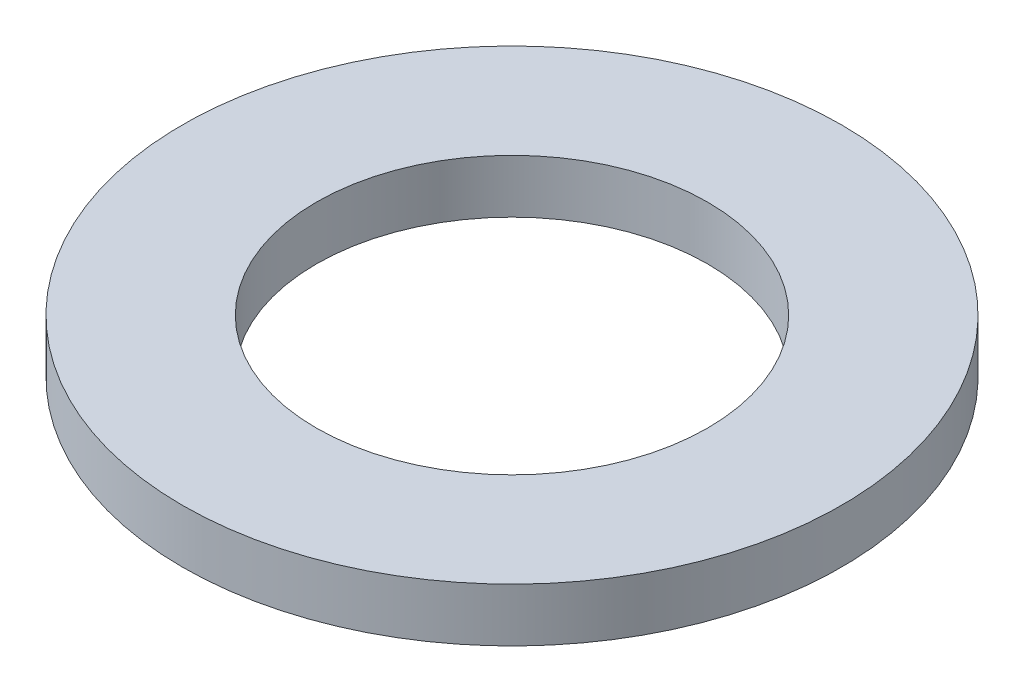
from build123d import *

# Parameters (mm, degrees)
SKETCH1_R           = 80
BOSS_EXTRUDE1_DEPTH = 13
SKETCH2_R           = 47.5
CUT_EXTRUDE1_DEPTH  = 114.881517377


with BuildPart() as part:
    # Sketch1 → Boss-Extrude1 (new body)
    with BuildSketch(Plane(origin=(0, 0, 0), x_dir=(1, 0, 0), z_dir=(0, 1, 0))):
        Circle(SKETCH1_R)
    extrude(amount=BOSS_EXTRUDE1_DEPTH)

    # Sketch2 → Cut-Extrude1 (cut, through all)
    with BuildSketch(Plane(origin=(0, 0, 0), x_dir=(1, 0, 0), z_dir=(0, 1, 0))):
        Circle(SKETCH2_R)
    extrude(amount=CUT_EXTRUDE1_DEPTH, mode=Mode.SUBTRACT)


solid = part.part
